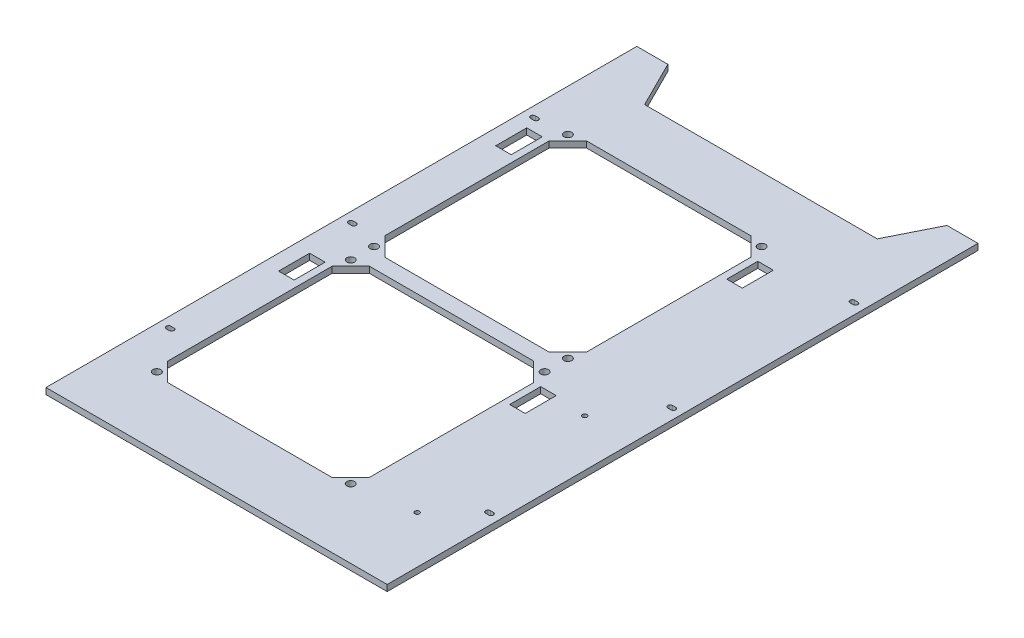
from build123d import *

# Parameters (mm, degrees)
SKETCH_1_W          = 220
SKETCH_1_H          = 381
EXTRUDE_1_DEPTH     = 4
F_3_0MM_3_D         = 3
SKETCH_6_W          = 10
SKETCH_6_H          = 20
CUT_EXTRUDE_1_DEPTH = 221.014204087
SKETCH_19_R         = 2.5
CUT_EXTRUDE_5_DEPTH = 221.014204087
CUT_EXTRUDE_6_DEPTH = 221.014204087
F_3_0MM_2_D         = 3
CUT_EXTRUDE_3_DEPTH = 221.014204087
CUT_EXTRUDE_4_DEPTH = 221.014204087


with BuildPart() as part:
    # 草圖1 → 填料-伸長1 (new body)
    with BuildSketch(Plane(origin=(0, 0, 0), x_dir=(1, 0, 0), z_dir=(0, 1, 0))):
        Rectangle(SKETCH_1_W, SKETCH_1_H)
    extrude(amount=EXTRUDE_1_DEPTH)

    # Ø3.0mm 定位孔3 (through all)
    with Locations(Plane(origin=(-103, 4, -117.5), x_dir=(0, 0, 1), z_dir=(0, 1, 0))):
        with Locations((0, 0), (0, 206), (117.5, 206), (117.5, 0), (235, 206), (235, 0)):
            Hole(F_3_0MM_3_D / 2)

    # 草圖6 → 除料-伸長1 (cut, through all)
    with BuildSketch(Plane(origin=(0, 4, 0), x_dir=(1, 0, 0), z_dir=(0, 1, 0))):
        with Locations((54, -40.5)):
            Rectangle(SKETCH_6_W, SKETCH_6_H)
        with Locations((-95, -40.5)):
            Rectangle(SKETCH_6_W, SKETCH_6_H)
        with Locations((-95, 99.5)):
            Rectangle(SKETCH_6_W, SKETCH_6_H)
        with Locations((54, 99.5)):
            Rectangle(SKETCH_6_W, SKETCH_6_H)
    extrude(amount=-CUT_EXTRUDE_1_DEPTH, mode=Mode.SUBTRACT)

    # 草圖19 → 除料-伸長5 (cut, through all)
    with BuildSketch(Plane(origin=(0, 4, 0), x_dir=(1, 0, 0), z_dir=(0, 1, 0))):
        with Locations((-83, 119)):
            Circle(SKETCH_19_R)
        with Locations((42, 119)):
            Circle(SKETCH_19_R)
        with Locations((42, -6)):
            Circle(SKETCH_19_R)
        with Locations((-83, -6)):
            Circle(SKETCH_19_R)
        with Locations((-83, -146)):
            Circle(SKETCH_19_R)
        with Locations((42, -146)):
            Circle(SKETCH_19_R)
        with Locations((42, -21)):
            Circle(SKETCH_19_R)
        with Locations((-83, -21)):
            Circle(SKETCH_19_R)
    extrude(amount=-CUT_EXTRUDE_5_DEPTH, mode=Mode.SUBTRACT)

    # 草圖20 → 除料-伸長6 (cut, through all)
    with BuildSketch(Plane(origin=(0, 4, 0), x_dir=(1, 0, 0), z_dir=(0, 1, 0))):
        Polygon((-85.5, 109.5), (-73.5, 121.5), (32.5, 121.5), (44.5, 109.5), (44.5, 3.5), (32.5, -8.5), (-73.5, -8.5), (-85.5, 3.5), align=None)
        Polygon((-73.5, -18.5), (32.5, -18.5), (44.5, -30.5), (44.5, -136.5), (32.5, -148.5), (-73.5, -148.5), (-85.5, -136.5), (-85.5, -30.5), align=None)
    extrude(amount=-CUT_EXTRUDE_6_DEPTH, mode=Mode.SUBTRACT)

    # Ø3.0mm 定位孔2 (through all)
    with Locations(Plane(origin=(79.5, 4, 32.62), x_dir=(0, 0, 1), z_dir=(0, 1, 0))):
        with Locations((0, 0), (108, 0)):
            Hole(F_3_0MM_2_D / 2)

    # 草圖16 → 除料-伸長3 (cut, through all)
    with BuildSketch(Plane(origin=(0, 4, 0), x_dir=(1, 0, 0), z_dir=(0, 1, 0))):
        Polygon((-90, 190.5), (90, 190.5), (75, 160.5), (-75, 160.5), align=None)
    extrude(amount=-CUT_EXTRUDE_3_DEPTH, mode=Mode.SUBTRACT)

    # 草圖17 → 除料-伸長4 (cut, through all)
    with BuildSketch(Plane(origin=(0, 4, 0), x_dir=(1, 0, 0), z_dir=(0, 1, 0))):
        with BuildLine():
            Line((-104, 119), (-102, 119))
            ThreePointArc((-102, 119), (-100.5, 117.5), (-102, 116))
            Line((-102, 116), (-104, 116))
            ThreePointArc((-104, 116), (-105.5, 117.5), (-104, 119))
        make_face()
        with BuildLine():
            Line((102, 119), (104, 119))
            ThreePointArc((104, 119), (105.5, 117.5), (104, 116))
            Line((104, 116), (102, 116))
            ThreePointArc((102, 116), (100.5, 117.5), (102, 119))
        make_face()
        with BuildLine():
            Line((102, 1.5), (104, 1.5))
            ThreePointArc((104, 1.5), (105.5, 0), (104, -1.5))
            Line((104, -1.5), (102, -1.5))
            ThreePointArc((102, -1.5), (100.5, 0), (102, 1.5))
        make_face()
        with BuildLine():
            Line((102, -116), (104, -116))
            ThreePointArc((104, -116), (105.5, -117.5), (104, -119))
            Line((104, -119), (102, -119))
            ThreePointArc((102, -119), (100.5, -117.5), (102, -116))
        make_face()
        with BuildLine():
            Line((-104, 1.5), (-102, 1.5))
            ThreePointArc((-102, 1.5), (-100.5, 0), (-102, -1.5))
            Line((-102, -1.5), (-104, -1.5))
            ThreePointArc((-104, -1.5), (-105.5, 0), (-104, 1.5))
        make_face()
        with BuildLine():
            Line((-104, -116), (-102, -116))
            ThreePointArc((-102, -116), (-100.5, -117.5), (-102, -119))
            Line((-102, -119), (-104, -119))
            ThreePointArc((-104, -119), (-105.5, -117.5), (-104, -116))
        make_face()
    extrude(amount=-CUT_EXTRUDE_4_DEPTH, mode=Mode.SUBTRACT)


solid = part.part
